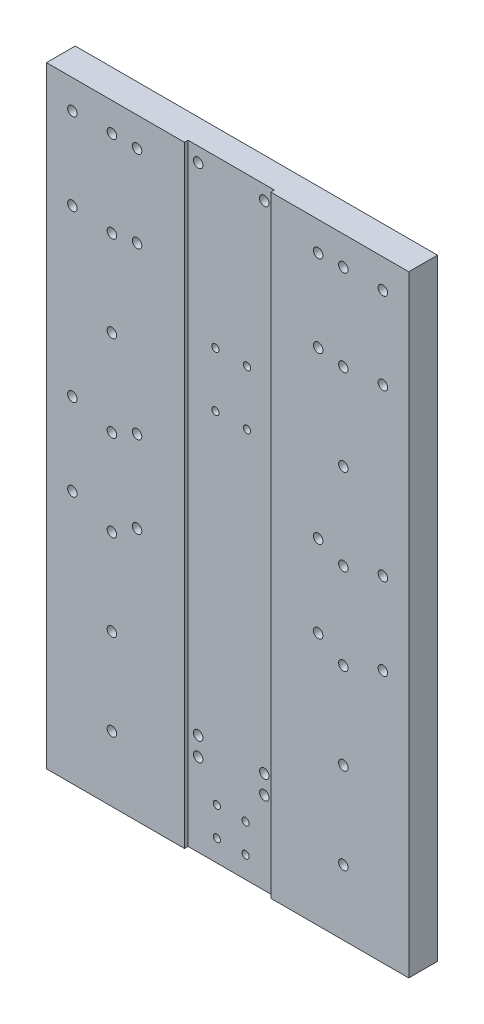
from build123d import *

# Parameters (mm, degrees)
SCHIZZO1_W                    = 252
SCHIZZO1_H                    = 500
ESTRUSIONE_ESTRUSIONE1_DEPTH  = 20
SCHIZZO3_W                    = 60
SCHIZZO3_H                    = 2.5
TAGLIO_ESTRUSIONE1_DEPTH      = 517.019379481
M6_CLEARANCE_HOLE2_AT_2_COUNT = 2
M6_CLEARANCE_HOLE2_AT_2_PITCH = 60
M6_CLEARANCE_HOLE2_AT_3_COUNT = 2
M6_CLEARANCE_HOLE2_AT_3_PITCH = 120
M6_CLEARANCE_HOLE2_AT_4_COUNT = 2
M6_CLEARANCE_HOLE2_AT_4_PITCH = 180
M6_CLEARANCE_HOLE2_AT_5_COUNT = 2
M6_CLEARANCE_HOLE2_AT_5_PITCH = 240
M6_CLEARANCE_HOLE2_AT_6_COUNT = 2
M6_CLEARANCE_HOLE2_AT_6_PITCH = 300
M6_CLEARANCE_HOLE2_AT_7_COUNT = 2
M6_CLEARANCE_HOLE2_AT_7_PITCH = 360
M6_CLEARANCE_HOLE4_AT_2_COUNT = 2
M6_CLEARANCE_HOLE4_AT_2_PITCH = 57
M6_CLEARANCE_HOLE4_AT_3_COUNT = 2
M6_CLEARANCE_HOLE4_AT_3_PITCH = 72.622310621
M6_CLEARANCE_HOLE4_AT_4_COUNT = 2
M6_CLEARANCE_HOLE4_AT_4_PITCH = 45
M6_CLEARANCE_HOLE4_AT_5_COUNT = 2
M6_CLEARANCE_HOLE4_AT_5_PITCH = 123.490890378
M6_CLEARANCE_HOLE4_AT_6_COUNT = 2
M6_CLEARANCE_HOLE4_AT_6_PITCH = 177.789201049
M6_CLEARANCE_HOLE4_AT_7_COUNT = 2
M6_CLEARANCE_HOLE4_AT_7_PITCH = 172.000000028
M6_CLEARANCE_HOLE4_AT_8_COUNT = 2
M6_CLEARANCE_HOLE4_AT_8_PITCH = 115.000000028
M6_CLEARANCE_HOLE3_D          = 6.6
M6_CLEARANCE_HOLE3_DEPTH      = 36.6
M6_CLEARANCE_HOLE3_TIP        = 1.982840043
SKETCH16_W                    = 252
SKETCH16_H                    = 142.479931771
CUT_EXTRUDE1_DEPTH            = 28
TAP_DRILL_FOR_M6_TAP1_D       = 5
TAP_DRILL_FOR_M6_TAP2_D       = 5
TAP_DRILL_FOR_M6_TAP2_DEPTH   = 30
TAP_DRILL_FOR_M6_TAP2_TIP     = 1.502151548
TAP_DRILL_FOR_M6_TAP3_D       = 5


with BuildPart() as part:
    # Schizzo1 → Estrusione-Estrusione1 (new body)
    with BuildSketch(Plane.XY):
        Rectangle(SCHIZZO1_W, SCHIZZO1_H)
    extrude(amount=ESTRUSIONE_ESTRUSIONE1_DEPTH)

    # Schizzo3 → Taglio-Estrusione1 (cut, through all)
    with BuildSketch(Plane(origin=(0, 250, 0), x_dir=(1, 0, 0), z_dir=(0, 1, 0))):
        with Locations((0, -18.75)):
            Rectangle(SCHIZZO3_W, SCHIZZO3_H)
    extrude(amount=-TAGLIO_ESTRUSIONE1_DEPTH, mode=Mode.SUBTRACT)

    # Sketch8 → M6 Clearance Hole2 (revolve, cut)
    with BuildSketch(Plane(origin=(80.500605801, -130, 20), x_dir=(0, -1, 0), z_dir=(1, 0, 0))):
        Polygon((0, 0), (0, 38.582840043), (3.3, 36.6), (3.3, 0), align=None)
    m6_clearance_hole2 = revolve(axis=Axis((80.500605801, -130, 26.35), (0, 0, -1)), mode=Mode.SUBTRACT)

    # M6 Clearance Hole2 at 2: M6 Clearance Hole2 ×2
    with Locations(*[(0, i * M6_CLEARANCE_HOLE2_AT_2_PITCH, 0) for i in range(1, M6_CLEARANCE_HOLE2_AT_2_COUNT)]):
        add(m6_clearance_hole2, mode=Mode.SUBTRACT)

    # M6 Clearance Hole2 at 3: M6 Clearance Hole2 ×2
    with Locations(*[(0, i * M6_CLEARANCE_HOLE2_AT_3_PITCH, 0) for i in range(1, M6_CLEARANCE_HOLE2_AT_3_COUNT)]):
        add(m6_clearance_hole2, mode=Mode.SUBTRACT)

    # M6 Clearance Hole2 at 4: M6 Clearance Hole2 ×2
    with Locations(*[(0, i * M6_CLEARANCE_HOLE2_AT_4_PITCH, 0) for i in range(1, M6_CLEARANCE_HOLE2_AT_4_COUNT)]):
        add(m6_clearance_hole2, mode=Mode.SUBTRACT)

    # M6 Clearance Hole2 at 5: M6 Clearance Hole2 ×2
    with Locations(*[(0, i * M6_CLEARANCE_HOLE2_AT_5_PITCH, 0) for i in range(1, M6_CLEARANCE_HOLE2_AT_5_COUNT)]):
        add(m6_clearance_hole2, mode=Mode.SUBTRACT)

    # M6 Clearance Hole2 at 6: M6 Clearance Hole2 ×2
    with Locations(*[(0, i * M6_CLEARANCE_HOLE2_AT_6_PITCH, 0) for i in range(1, M6_CLEARANCE_HOLE2_AT_6_COUNT)]):
        add(m6_clearance_hole2, mode=Mode.SUBTRACT)

    # M6 Clearance Hole2 at 7: M6 Clearance Hole2 ×2
    with Locations(*[(0, i * M6_CLEARANCE_HOLE2_AT_7_PITCH, 0) for i in range(1, M6_CLEARANCE_HOLE2_AT_7_COUNT)]):
        add(m6_clearance_hole2, mode=Mode.SUBTRACT)

    # Sketch15 → M6 Clearance Hole4 (revolve, cut)
    with BuildSketch(Plane(origin=(108, 172.808299679, 20), x_dir=(0, -1, 0), z_dir=(1, 0, 0))):
        Polygon((0, 0), (0, 38.582840043), (3.3, 36.6), (3.3, 0), align=None)
    m6_clearance_hole4 = revolve(axis=Axis((108, 172.808299679, 26.35), (0, 0, -1)), mode=Mode.SUBTRACT)

    # M6 Clearance Hole4 at 2: M6 Clearance Hole4 ×2
    with Locations(*[(0, i * M6_CLEARANCE_HOLE4_AT_2_PITCH, 0) for i in range(1, M6_CLEARANCE_HOLE4_AT_2_COUNT)]):
        add(m6_clearance_hole4, mode=Mode.SUBTRACT)

    # M6 Clearance Hole4 at 3: M6 Clearance Hole4 ×2
    with Locations(*[Vector(-0.6196442885790133, 0.7848827655334322, 0) * (i * M6_CLEARANCE_HOLE4_AT_3_PITCH) for i in range(1, M6_CLEARANCE_HOLE4_AT_3_COUNT)]):
        add(m6_clearance_hole4, mode=Mode.SUBTRACT)

    # M6 Clearance Hole4 at 4: M6 Clearance Hole4 ×2
    with Locations(*[(-i * M6_CLEARANCE_HOLE4_AT_4_PITCH, 0, 0) for i in range(1, M6_CLEARANCE_HOLE4_AT_4_COUNT)]):
        add(m6_clearance_hole4, mode=Mode.SUBTRACT)

    # M6 Clearance Hole4 at 5: M6 Clearance Hole4 ×2
    with Locations(*[Vector(-0.3643993485034955, -0.9312427797358904, 0) * (i * M6_CLEARANCE_HOLE4_AT_5_PITCH) for i in range(1, M6_CLEARANCE_HOLE4_AT_5_COUNT)]):
        add(m6_clearance_hole4, mode=Mode.SUBTRACT)

    # M6 Clearance Hole4 at 6: M6 Clearance Hole4 ×2
    with Locations(*[Vector(-0.2531087362700926, -0.9674378365681987, 0) * (i * M6_CLEARANCE_HOLE4_AT_6_PITCH) for i in range(1, M6_CLEARANCE_HOLE4_AT_6_COUNT)]):
        add(m6_clearance_hole4, mode=Mode.SUBTRACT)

    # M6 Clearance Hole4 at 7: M6 Clearance Hole4 ×2
    with Locations(*[(0, -i * M6_CLEARANCE_HOLE4_AT_7_PITCH, 0) for i in range(1, M6_CLEARANCE_HOLE4_AT_7_COUNT)]):
        add(m6_clearance_hole4, mode=Mode.SUBTRACT)

    # M6 Clearance Hole4 at 8: M6 Clearance Hole4 ×2
    with Locations(*[(0, -i * M6_CLEARANCE_HOLE4_AT_8_PITCH, 0) for i in range(1, M6_CLEARANCE_HOLE4_AT_8_COUNT)]):
        add(m6_clearance_hole4, mode=Mode.SUBTRACT)

    # M6 Clearance Hole3
    with Locations(Plane.XY.offset(17.5)):
        with Locations((23, -118), (23, -105), (-23, -118), (-23, -105), (23, 240), (-23, 240)):
            Hole(M6_CLEARANCE_HOLE3_D / 2, depth=M6_CLEARANCE_HOLE3_DEPTH)
            with Locations((0, 0, -(M6_CLEARANCE_HOLE3_DEPTH + M6_CLEARANCE_HOLE3_TIP / 2))):  # 118° drill point
                Cone(0, M6_CLEARANCE_HOLE3_D / 2, M6_CLEARANCE_HOLE3_TIP, mode=Mode.SUBTRACT)

    # Mirror1: M6 Clearance Hole2 across plane
    add(m6_clearance_hole2.mirror(Plane.ZY), mode=Mode.SUBTRACT)

    # Mirror1 copy 1 sketch → Mirror1 copy 1 (revolve, cut)
    with BuildSketch(Plane(origin=(-80.500605801, -70, 20), x_dir=(0, -1, 0), z_dir=(-1, 0, 0))):
        Polygon((0, 0), (0, -38.582840043), (3.3, -36.6), (3.3, 0), align=None)
    revolve(axis=Axis((-80.500605801, -70, 26.35), (0, 0, 1)), mode=Mode.SUBTRACT)

    # Mirror1 copy 2 sketch → Mirror1 copy 2 (revolve, cut)
    with BuildSketch(Plane(origin=(-80.500605801, -10, 20), x_dir=(0, -1, 0), z_dir=(-1, 0, 0))):
        Polygon((0, 0), (0, -38.582840043), (3.3, -36.6), (3.3, 0), align=None)
    revolve(axis=Axis((-80.500605801, -10, 26.35), (0, 0, 1)), mode=Mode.SUBTRACT)

    # Mirror1 copy 3 sketch → Mirror1 copy 3 (revolve, cut)
    with BuildSketch(Plane(origin=(-80.500605801, 50, 20), x_dir=(0, -1, 0), z_dir=(-1, 0, 0))):
        Polygon((0, 0), (0, -38.582840043), (3.3, -36.6), (3.3, 0), align=None)
    revolve(axis=Axis((-80.500605801, 50, 26.35), (0, 0, 1)), mode=Mode.SUBTRACT)

    # Mirror1 copy 4 sketch → Mirror1 copy 4 (revolve, cut)
    with BuildSketch(Plane(origin=(-80.500605801, 110, 20), x_dir=(0, -1, 0), z_dir=(-1, 0, 0))):
        Polygon((0, 0), (0, -38.582840043), (3.3, -36.6), (3.3, 0), align=None)
    revolve(axis=Axis((-80.500605801, 110, 26.35), (0, 0, 1)), mode=Mode.SUBTRACT)

    # Mirror1 copy 5 sketch → Mirror1 copy 5 (revolve, cut)
    with BuildSketch(Plane(origin=(-80.500605801, 170, 20), x_dir=(0, -1, 0), z_dir=(-1, 0, 0))):
        Polygon((0, 0), (0, -38.582840043), (3.3, -36.6), (3.3, 0), align=None)
    revolve(axis=Axis((-80.500605801, 170, 26.35), (0, 0, 1)), mode=Mode.SUBTRACT)

    # Mirror1 copy 6 sketch → Mirror1 copy 6 (revolve, cut)
    with BuildSketch(Plane(origin=(-80.500605801, 230, 20), x_dir=(0, -1, 0), z_dir=(-1, 0, 0))):
        Polygon((0, 0), (0, -38.582840043), (3.3, -36.6), (3.3, 0), align=None)
    revolve(axis=Axis((-80.500605801, 230, 26.35), (0, 0, 1)), mode=Mode.SUBTRACT)

    # Mirror2: M6 Clearance Hole4 across plane
    add(m6_clearance_hole4.mirror(Plane.ZY), mode=Mode.SUBTRACT)

    # Mirror2 copy 1 sketch → Mirror2 copy 1 (revolve, cut)
    with BuildSketch(Plane(origin=(-108, 229.808299679, 20), x_dir=(0, -1, 0), z_dir=(-1, 0, 0))):
        Polygon((0, 0), (0, -38.582840043), (3.3, -36.6), (3.3, 0), align=None)
    revolve(axis=Axis((-108, 229.808299679, 26.35), (0, 0, 1)), mode=Mode.SUBTRACT)

    # Mirror2 copy 2 sketch → Mirror2 copy 2 (revolve, cut)
    with BuildSketch(Plane(origin=(-63, 229.808299679, 20), x_dir=(0, -1, 0), z_dir=(-1, 0, 0))):
        Polygon((0, 0), (0, -38.582840043), (3.3, -36.6), (3.3, 0), align=None)
    revolve(axis=Axis((-63, 229.808299679, 26.35), (0, 0, 1)), mode=Mode.SUBTRACT)

    # Mirror2 copy 3 sketch → Mirror2 copy 3 (revolve, cut)
    with BuildSketch(Plane(origin=(-63, 172.808299679, 20), x_dir=(0, -1, 0), z_dir=(-1, 0, 0))):
        Polygon((0, 0), (0, -38.582840043), (3.3, -36.6), (3.3, 0), align=None)
    revolve(axis=Axis((-63, 172.808299679, 26.35), (0, 0, 1)), mode=Mode.SUBTRACT)

    # Mirror2 copy 4 sketch → Mirror2 copy 4 (revolve, cut)
    with BuildSketch(Plane(origin=(-63, 57.808299651, 20), x_dir=(0, -1, 0), z_dir=(-1, 0, 0))):
        Polygon((0, 0), (0, -38.582840043), (3.3, -36.6), (3.3, 0), align=None)
    revolve(axis=Axis((-63, 57.808299651, 26.35), (0, 0, 1)), mode=Mode.SUBTRACT)

    # Mirror2 copy 5 sketch → Mirror2 copy 5 (revolve, cut)
    with BuildSketch(Plane(origin=(-63, 0.808299651, 20), x_dir=(0, -1, 0), z_dir=(-1, 0, 0))):
        Polygon((0, 0), (0, -38.582840043), (3.3, -36.6), (3.3, 0), align=None)
    revolve(axis=Axis((-63, 0.808299651, 26.35), (0, 0, 1)), mode=Mode.SUBTRACT)

    # Mirror2 copy 6 sketch → Mirror2 copy 6 (revolve, cut)
    with BuildSketch(Plane(origin=(-108, 0.808299651, 20), x_dir=(0, -1, 0), z_dir=(-1, 0, 0))):
        Polygon((0, 0), (0, -38.582840043), (3.3, -36.6), (3.3, 0), align=None)
    revolve(axis=Axis((-108, 0.808299651, 26.35), (0, 0, 1)), mode=Mode.SUBTRACT)

    # Mirror2 copy 7 sketch → Mirror2 copy 7 (revolve, cut)
    with BuildSketch(Plane(origin=(-108, 57.808299651, 20), x_dir=(0, -1, 0), z_dir=(-1, 0, 0))):
        Polygon((0, 0), (0, -38.582840043), (3.3, -36.6), (3.3, 0), align=None)
    revolve(axis=Axis((-108, 57.808299651, 26.35), (0, 0, 1)), mode=Mode.SUBTRACT)

    # Sketch16 → Cut-Extrude1 (cut)
    with BuildSketch(Plane(origin=(0, 0, 0), x_dir=(-1, 0, 0), z_dir=(0, 0, -1))):
        with Locations((0, -246.689965886)):
            Rectangle(SKETCH16_W, SKETCH16_H)
    extrude(amount=-CUT_EXTRUDE1_DEPTH, mode=Mode.SUBTRACT)

    # Tap Drill for M6 Tap1 (through all)
    with Locations(Plane.XY.offset(17.5)):
        with Locations((-11, 96.308299651), (11, 96.308299651), (11, 134.308299651), (-11, 134.308299651)):
            Hole(TAP_DRILL_FOR_M6_TAP1_D / 2)

    # Tap Drill for M6 Tap2
    with Locations(Plane(origin=(0, -175.45, 0), x_dir=(-1, 0, 0), z_dir=(0, -1, 0))):
        with Locations((20, -10), (-20, -10)):
            Hole(TAP_DRILL_FOR_M6_TAP2_D / 2, depth=TAP_DRILL_FOR_M6_TAP2_DEPTH)
            with Locations((0, 0, -(TAP_DRILL_FOR_M6_TAP2_DEPTH + TAP_DRILL_FOR_M6_TAP2_TIP / 2))):  # 118° drill point
                Cone(0, TAP_DRILL_FOR_M6_TAP2_D / 2, TAP_DRILL_FOR_M6_TAP2_TIP, mode=Mode.SUBTRACT)

    # Tap Drill for M6 Tap3 (through all)
    with Locations(Plane(origin=(0, 0, 0), x_dir=(-1, 0, 0), z_dir=(0, 0, -1))):
        with Locations((-10, -160.45), (-10, -140.45), (10, -140.45), (10, -160.45)):
            Hole(TAP_DRILL_FOR_M6_TAP3_D / 2)


solid = part.part
